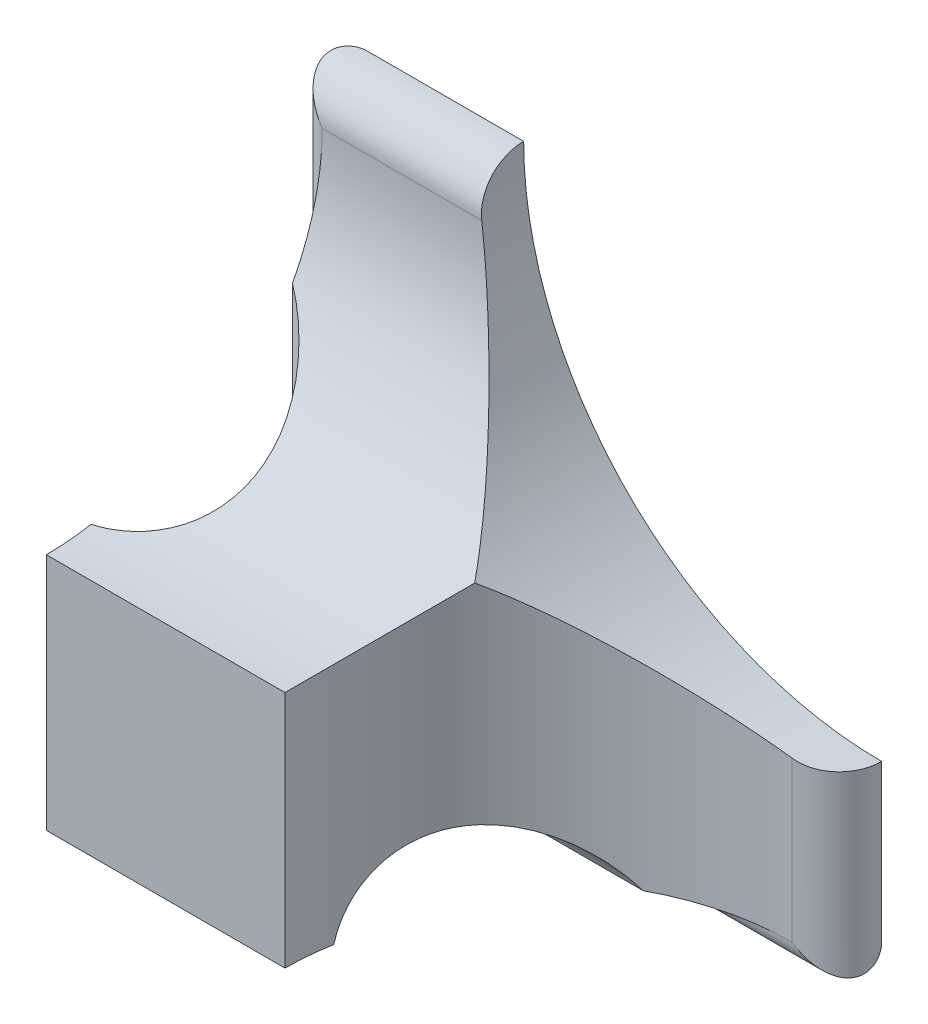
from build123d import *

# Parameters (mm, degrees)
EXTRUDE_494_DEPTH      = 10
CUT_EXTRUDE_1131_DEPTH = 23.683250881
CUT_EXTRUDE_1421_DEPTH = 23.683250881
CUT_EXTRUDE_START      = -3
CUT_EXTRUDE_1883_DEPTH = 26.683251046
CHAMFER_1_SIZE         = 0.5


with BuildPart() as part:
    # Эскиз1 → Extrude 494 (new body)
    with BuildSketch(Plane.XY):
        with BuildLine():
            Line((0, 0), (18, 0))
            Line((18, 0), (18, 6))
            ThreePointArc((18, 6), (13.407798812, 6.91344561), (9.514718626, 9.514718626))
            Line((9.514718626, 9.514718626), (0, 0))
        make_face()
    extrude_494 = extrude(amount=EXTRUDE_494_DEPTH)

    # Эскиз2 → Cut-Extrude 1131 (cut, through all)
    with BuildSketch(Plane(origin=(18, 0, 0), x_dir=(0, 0, -1), z_dir=(1, 0, 0))):
        with BuildLine():
            Line((-10, -1), (0, -1))
            Line((0, -1), (0, 0.75))
            ThreePointArc((0, 0.75), (-0.75, 0), (-1.5, 0.75))
            Line((-1.5, 0.75), (-2.5, 0.75))
            ThreePointArc((-2.5, 0.75), (-5.762519138, 2.475153108), (-8.5, 0))
            Line((-8.5, 0), (-10, 0))
            Line((-10, 0), (-10, -1))
        make_face()
    cut_extrude_1131 = extrude(amount=-CUT_EXTRUDE_1131_DEPTH, mode=Mode.SUBTRACT)

    # Эскиз3 → Cut-Extrude 1421 (cut, through all)
    with BuildSketch(Plane(origin=(0, 0, 0), x_dir=(1, 0, 0), z_dir=(0, 1, 0))):
        with BuildLine():
            Line((18, 0), (18, -10))
            Line((18, -10), (8, -10))
            ThreePointArc((8, -10), (10.48959236, -3.98959236), (16.5, -1.5))
            ThreePointArc((16.5, -1.5), (17.560660172, -1.060660172), (18, 0))
        make_face()
    cut_extrude_1421 = extrude(amount=CUT_EXTRUDE_1421_DEPTH, mode=Mode.SUBTRACT)

    # Эскиз5 → Cut-Extrude 1883 (cut)
    with BuildSketch(Plane(origin=(0, 0, 0), x_dir=(-1, 0, 0), z_dir=(0, 0, -1)).offset(CUT_EXTRUDE_START)):
        with BuildLine():
            ThreePointArc((-5.666547622, 5.666547622), (-6.737144673, 4.951197543), (-8, 4.7))
            Line((-8, 4.7), (-11, 4.7))
            Line((-11, 4.7), (-11, 3.3))
            Line((-11, 3.3), (-8, 3.3))
            ThreePointArc((-8, 3.3), (-6.201387868, 3.657766197), (-4.676598128, 4.676598128))
            Line((-4.676598128, 4.676598128), (-5.666547622, 5.666547622))
        make_face()
    cut_extrude_1883 = extrude(amount=CUT_EXTRUDE_1883_DEPTH, mode=Mode.SUBTRACT)

    # Зеркальное отражение1: Extrude 494, Cut-Extrude 1131, Cut-Extrude 1421, Cut-Extrude 1883 across plane
    add(extrude_494.mirror(Plane(origin=(9.514718626, 9.514718626, 10), x_dir=(0, 0, 1), z_dir=(0.7071067811865486, -0.7071067811865466, 0))))
    add(cut_extrude_1131.mirror(Plane(origin=(9.514718626, 9.514718626, 10), x_dir=(0, 0, 1), z_dir=(0.7071067811865486, -0.7071067811865466, 0))), mode=Mode.SUBTRACT)
    add(cut_extrude_1421.mirror(Plane(origin=(9.514718626, 9.514718626, 10), x_dir=(0, 0, 1), z_dir=(0.7071067811865486, -0.7071067811865466, 0))), mode=Mode.SUBTRACT)
    add(cut_extrude_1883.mirror(Plane(origin=(9.514718626, 9.514718626, 10), x_dir=(0, 0, 1), z_dir=(0.7071067811865486, -0.7071067811865466, 0))), mode=Mode.SUBTRACT)

    # Фаска1
    chamfer_1_edges = [part.edges().sort_by_distance(p)[0] for p in [
        (11, 4, 0),
        (9.5, 4.7, 0),
        (5.666547622, 5.666547622, 0),
        (9.5, 3.3, 0),
        (4.676598128, 4.676598128, 0),
        (4.7, 9.5, 0),
        (3.3, 9.5, 0),
        (4, 11, 0),
    ]]
    chamfer(chamfer_1_edges, length=CHAMFER_1_SIZE)


solid = part.part
